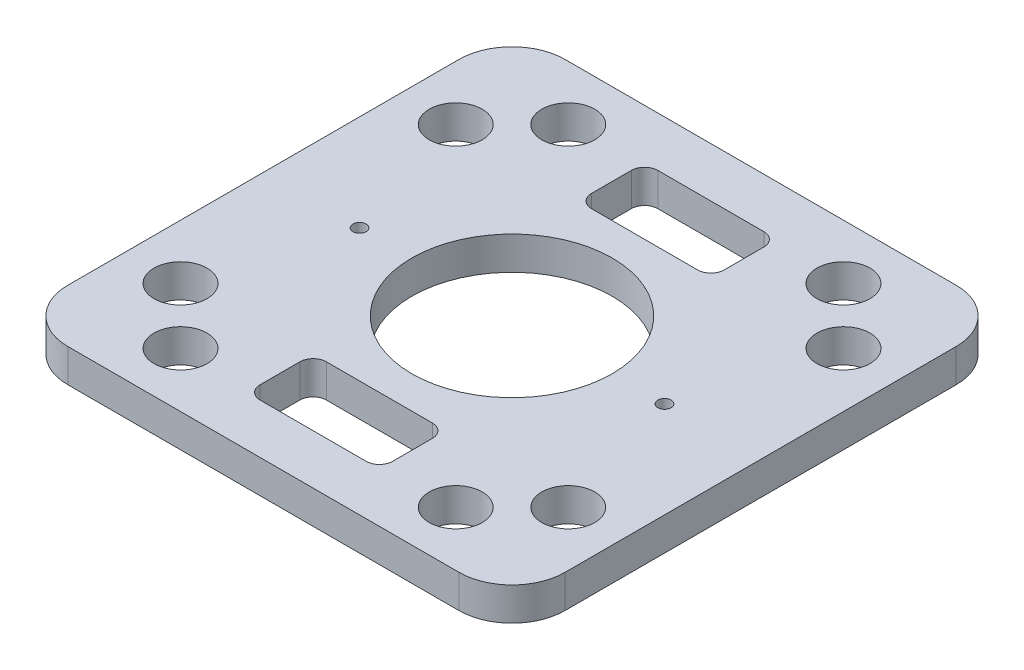
from build123d import *

# Parameters (mm, degrees)
SKETCH2_W           = 75
SKETCH2_H           = 75
SKETCH2_R           = 15.119722523
SKETCH2_R_2         = 1
SKETCH2_R_3         = 4
SKETCH2_W_2         = 20
SKETCH2_H_2         = 10
BOSS_EXTRUDE2_DEPTH = 5
FILLET1_R           = 8
FILLET2_R           = 2


with BuildPart() as part:
    # Sketch2 → Boss-Extrude2 (new body)
    with BuildSketch(Plane(origin=(0, 0, 0), x_dir=(1, 0, 0), z_dir=(0, 1, 0))):
        Rectangle(SKETCH2_W, SKETCH2_H)
        Circle(SKETCH2_R, mode=Mode.SUBTRACT)
        with Locations((-23, 0)):
            Circle(SKETCH2_R_2, mode=Mode.SUBTRACT)
        with Locations((23, 0)):
            Circle(SKETCH2_R_2, mode=Mode.SUBTRACT)
        with Locations((29.242640687, 20.757359313)):
            Circle(SKETCH2_R_3, mode=Mode.SUBTRACT)
        with Locations((20.757359313, 29.242640687)):
            Circle(SKETCH2_R_3, mode=Mode.SUBTRACT)
        with Locations((-20.757359313, -29.242640687)):
            Circle(SKETCH2_R_3, mode=Mode.SUBTRACT)
        with Locations((-29.242640687, -20.757359313)):
            Circle(SKETCH2_R_3, mode=Mode.SUBTRACT)
        with Locations((-20.757359313, 29.242640687)):
            Circle(SKETCH2_R_3, mode=Mode.SUBTRACT)
        with Locations((-29.242640687, 20.757359313)):
            Circle(SKETCH2_R_3, mode=Mode.SUBTRACT)
        with Locations((29.242640687, -20.757359313)):
            Circle(SKETCH2_R_3, mode=Mode.SUBTRACT)
        with Locations((20.757359313, -29.242640687)):
            Circle(SKETCH2_R_3, mode=Mode.SUBTRACT)
        with Locations((0, -25)):
            Rectangle(SKETCH2_W_2, SKETCH2_H_2, mode=Mode.SUBTRACT)
        with Locations((0, 25)):
            Rectangle(SKETCH2_W_2, SKETCH2_H_2, mode=Mode.SUBTRACT)
    extrude(amount=BOSS_EXTRUDE2_DEPTH)

    # Fillet1
    fillet1_edges = [part.edges().sort_by_distance(p)[0] for p in [
        (-37.5, 2.5, 37.5),
        (-37.5, 2.5, -37.5),
        (37.5, 2.5, 37.5),
        (37.5, 2.5, -37.5),
    ]]
    fillet(fillet1_edges, radius=FILLET1_R)

    # Fillet2
    fillet2_edges = [part.edges().sort_by_distance(p)[0] for p in [
        (-10, 2.5, 20),
        (-10, 2.5, 30),
        (10, 2.5, 30),
        (10, 2.5, 20),
        (-10, 2.5, -20),
        (-10, 2.5, -30),
        (10, 2.5, -20),
        (10, 2.5, -30),
    ]]
    fillet(fillet2_edges, radius=FILLET2_R)


solid = part.part
